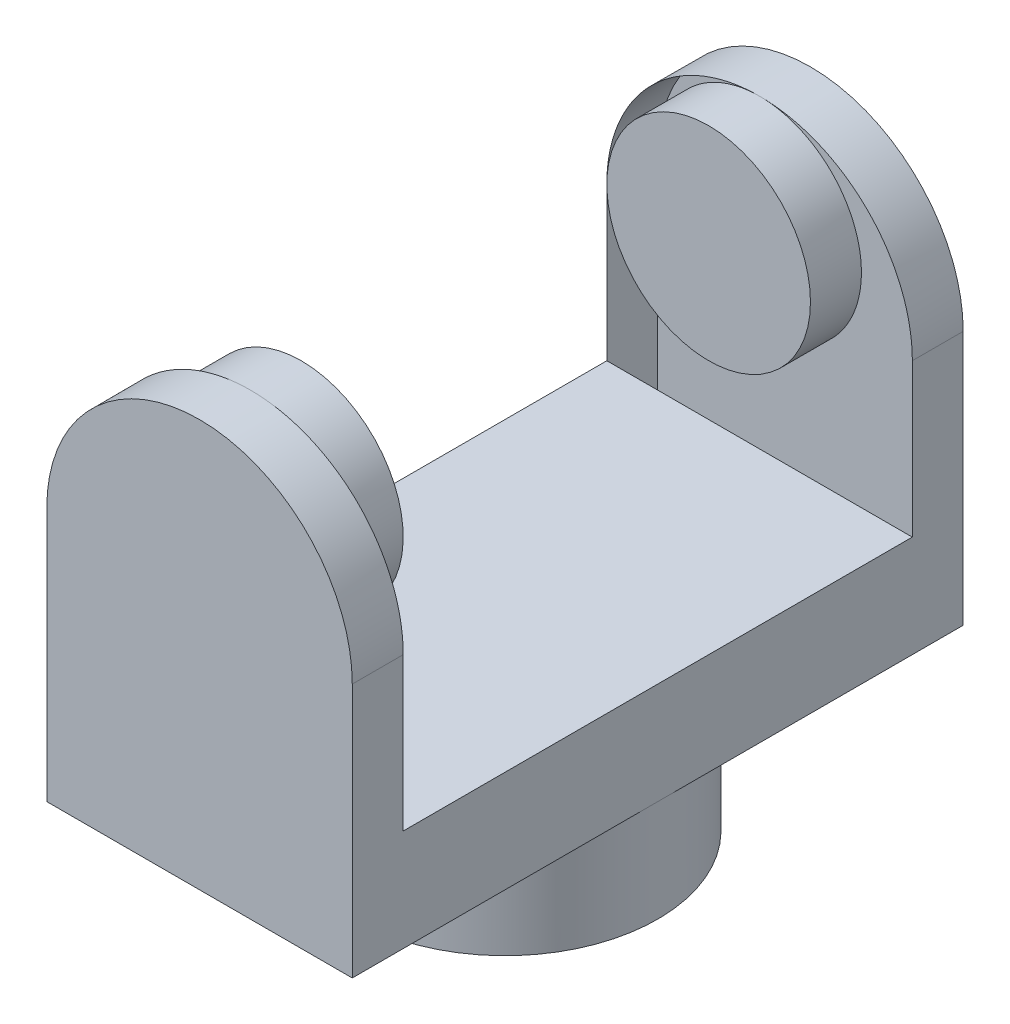
from build123d import *

# Parameters (mm, degrees)
ESBO_O1_R                = 1.5
RESSALTO_EXTRUS_O1_DEPTH = 1
ESBO_O3_W                = 3
ESBO_O3_H                = 6
RESSALTO_EXTRUS_O2_DEPTH = 1
ESBO_O4_R                = 1.5
RESSALTO_EXTRUS_O3_DEPTH = 0.5
ESBO_O5_R                = 1
RESSALTO_EXTRUS_O4_DEPTH = 0.5
RESSALTO_EXTRUS_O5_DEPTH = 0.5
ESBO_O7_R                = 1.5
RESSALTO_EXTRUS_O6_DEPTH = 0.5
RESSALTO_EXTRUS_O7_START = 0.5
ESBO_O8_R                = 1
RESSALTO_EXTRUS_O7_DEPTH = 0.5
RESSALTO_EXTRUS_O8_START = -0.5
RESSALTO_EXTRUS_O8_DEPTH = 0.5
ESCALA1_SCALE            = 10


with BuildPart() as part:
    # Esboço1 → Ressalto-extrusão1 (new body)
    with BuildSketch(Plane(origin=(0, 0, 0), x_dir=(1, 0, 0), z_dir=(0, 1, 0))):
        Circle(ESBO_O1_R)
    extrude(amount=-RESSALTO_EXTRUS_O1_DEPTH)

    # Esboço3 → Ressalto-extrusão2 (add)
    with BuildSketch(Plane(origin=(0, 0, 0), x_dir=(1, 0, 0), z_dir=(0, 1, 0))):
        Rectangle(ESBO_O3_W, ESBO_O3_H)
    extrude(amount=RESSALTO_EXTRUS_O2_DEPTH)



with BuildPart() as body_2:
    # Esboço4 → Ressalto-extrusão3 (new body)
    with BuildSketch(Plane.XY.offset(3)):
        with Locations((0, 2.5)):
            Circle(ESBO_O4_R)
    extrude(amount=-RESSALTO_EXTRUS_O3_DEPTH)

    # Esboço5 → Ressalto-extrusão4 (add)
    with BuildSketch(Plane(origin=(0, 0, 2.5), x_dir=(-1, 0, 0), z_dir=(0, 0, -1))):
        with Locations((0, 3)):
            Circle(ESBO_O5_R)
    extrude(amount=RESSALTO_EXTRUS_O4_DEPTH)


with BuildPart() as part_1:
    add(part.part)

    add(body_2.part)  # Ressalto-extrusão5 merges body 2
    # Esboço6 → Ressalto-extrusão5 (add)
    with BuildSketch(Plane(origin=(0, 0, 2.5), x_dir=(-1, 0, 0), z_dir=(0, 0, -1))):
        with BuildLine():
            ThreePointArc((0, 1), (-1.060660172, 1.439339828), (-1.5, 2.5))
            Line((-1.5, 2.5), (-1.5, 1))
            Line((-1.5, 1), (0, 1))
        make_face()
        with BuildLine():
            ThreePointArc((1.5, 2.5), (1.060660172, 1.439339828), (0, 1))
            Line((0, 1), (1.5, 1))
            Line((1.5, 1), (1.5, 2.5))
        make_face()
    extrude(amount=-RESSALTO_EXTRUS_O5_DEPTH)



with BuildPart() as body_2_2:
    # Esboço7 → Ressalto-extrusão6 (new body)
    with BuildSketch(Plane(origin=(0, 0, -3), x_dir=(-1, 0, 0), z_dir=(0, 0, -1))):
        with Locations((0, 2.5)):
            Circle(ESBO_O7_R)
    extrude(amount=-RESSALTO_EXTRUS_O6_DEPTH)

    # Esboço8 → Ressalto-extrusão7 (add)
    with BuildSketch(Plane.XY.offset(-2.5).offset(RESSALTO_EXTRUS_O7_START)):
        with Locations((0, 3)):
            Circle(ESBO_O8_R)
    extrude(amount=-RESSALTO_EXTRUS_O7_DEPTH)


with BuildPart() as part_2:
    add(part_1.part)

    add(body_2_2.part)  # Ressalto-extrusão8 merges body 2 2
    # Esboço9 → Ressalto-extrusão8 (add)
    with BuildSketch(Plane(origin=(0, 0, -3), x_dir=(-1, 0, 0), z_dir=(0, 0, -1)).offset(RESSALTO_EXTRUS_O8_START)):
        with BuildLine():
            ThreePointArc((0, 1), (-1.060660172, 1.439339828), (-1.5, 2.5))
            Line((-1.5, 2.5), (-1.5, 1))
            Line((-1.5, 1), (0, 1))
        make_face()
        with BuildLine():
            ThreePointArc((1.5, 2.5), (1.060660172, 1.439339828), (0, 1))
            Line((0, 1), (1.5, 1))
            Line((1.5, 1), (1.5, 2.5))
        make_face()
    extrude(amount=RESSALTO_EXTRUS_O8_DEPTH)


with BuildPart() as part_3:
    # Escala1: scaled about (0, 0, 0)
    add(part_2.part.scale(ESCALA1_SCALE))


solid = part_3.part
